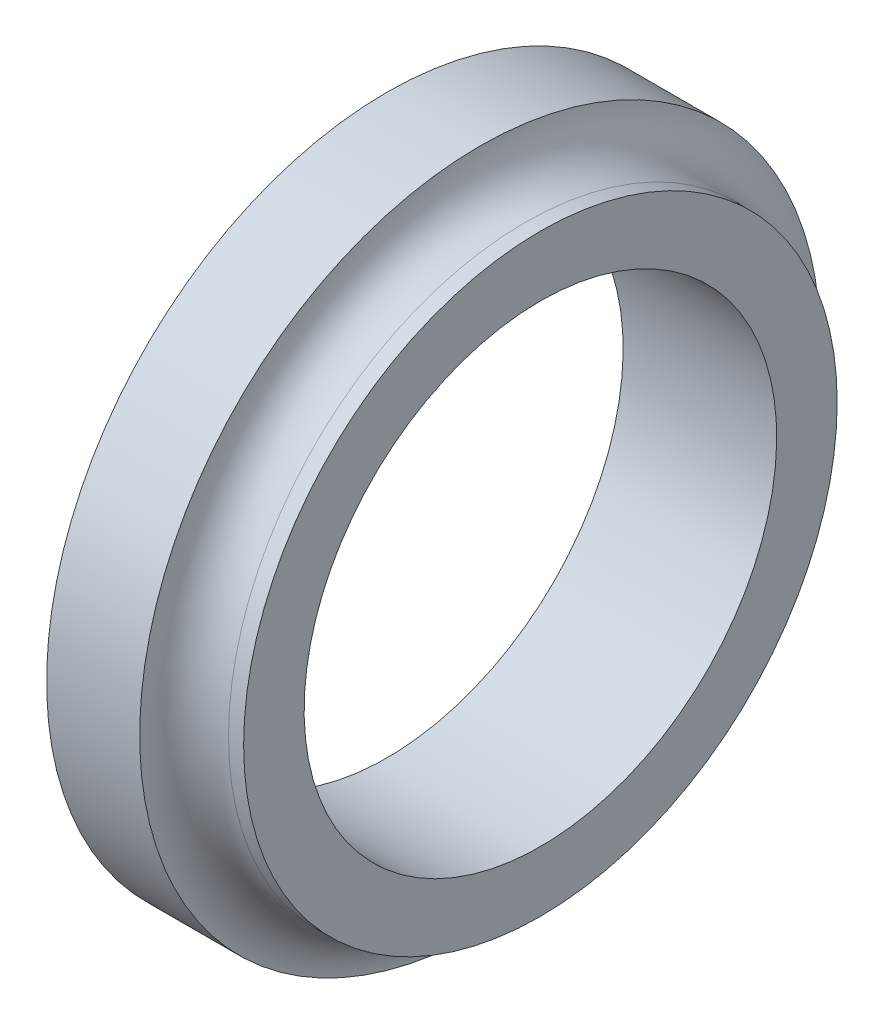
from build123d import *


with BuildPart() as part:
    # Sketch1 → Revolve1 (revolve)
    with BuildSketch(Plane.XY):
        with BuildLine():
            Line((-6.050624956, 5.715), (-6.050624956, 3.96875))
            Line((-6.050624956, 3.96875), (-3.471875, 3.96875))
            Line((-3.471875, 3.96875), (-3.471875, 4.98475))
            Line((-3.471875, 4.98475), (-3.725875, 4.98475))
            ThreePointArc((-3.725875, 4.98475), (-4.253345615, 5.196823869), (-4.487213254, 5.715))
            Line((-4.487213254, 5.715), (-6.050624956, 5.715))
        make_face()
    revolve(axis=Axis((0, 0, 0), (-1, 0, 0)))


solid = part.part
